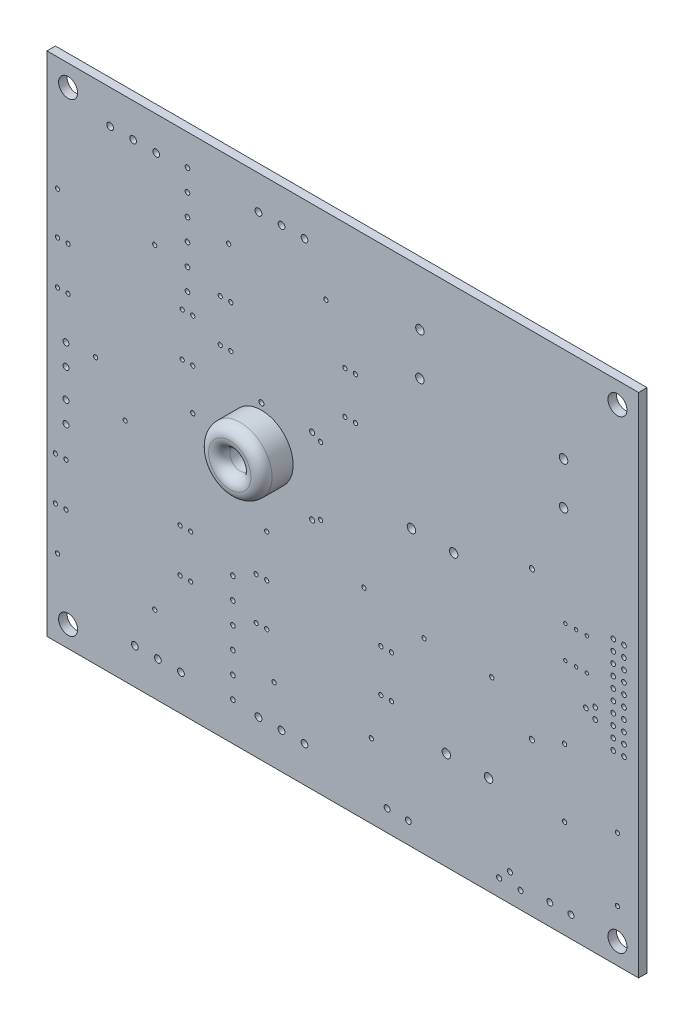
from build123d import *

# Parameters (mm, degrees)
SKETCH_1_W          = 140
SKETCH_1_H          = 120
SKETCH_1_R          = 2.25
EXTRUDE_1_DEPTH     = 2
SKETCH_2_R          = 0.55
SKETCH_2_R_2        = 0.5
SKETCH_2_R_3        = 0.8
CUT_EXTRUDE_1_DEPTH = 2
SKETCH_3_R          = 0.4
SKETCH_3_R_2        = 0.55
SKETCH_3_R_3        = 0.7
SKETCH_3_R_4        = 0.6
SKETCH_3_R_5        = 0.5
SKETCH_3_R_6        = 1
CUT_EXTRUDE_2_DEPTH = 10
SKETCH_4_R          = 0.6
SKETCH_4_R_2        = 0.5
CUT_EXTRUDE_3_DEPTH = 10
SKETCH_5_R          = 7.5
SKETCH_5_R_2        = 2.5
EXTRUDE_2_DEPTH     = 7.5
FILLET_1_R          = 2.5


with BuildPart() as part:
    # Эскиз1 → Вытянуть1 (new body)
    with BuildSketch(Plane.XY):
        Rectangle(SKETCH_1_W, SKETCH_1_H)
        with Locations((-65, -55)):
            Circle(SKETCH_1_R, mode=Mode.SUBTRACT)
        with Locations(Location((65, -55, 0), (0, 0, 180))):
            Circle(SKETCH_1_R, mode=Mode.SUBTRACT)
        with Locations((65, 55)):
            Circle(SKETCH_1_R, mode=Mode.SUBTRACT)
        with Locations(Location((-65, 55, 0), (0, 0, 180))):
            Circle(SKETCH_1_R, mode=Mode.SUBTRACT)
    extrude(amount=EXTRUDE_1_DEPTH)

    # Эскиз2 → Вырез-Вытянуть1 (cut)
    with BuildSketch(Plane.XY.offset(2)):
        with Locations((64, 6.5)):
            Circle(SKETCH_2_R)
        with Locations((66.54, 6.5)):
            Circle(SKETCH_2_R)
        with Locations((64, 3.96)):
            Circle(SKETCH_2_R)
        with Locations((66.54, 3.96)):
            Circle(SKETCH_2_R)
        with Locations((64, 1.42)):
            Circle(SKETCH_2_R)
        with Locations((66.54, 1.42)):
            Circle(SKETCH_2_R)
        with Locations((64, -1.12)):
            Circle(SKETCH_2_R)
        with Locations((66.54, -1.12)):
            Circle(SKETCH_2_R)
        with Locations((64, -3.66)):
            Circle(SKETCH_2_R)
        with Locations((66.54, -3.66)):
            Circle(SKETCH_2_R)
        with Locations((64, -6.2)):
            Circle(SKETCH_2_R)
        with Locations((66.54, -6.2)):
            Circle(SKETCH_2_R)
        with Locations((64, -8.74)):
            Circle(SKETCH_2_R)
        with Locations((66.54, -8.74)):
            Circle(SKETCH_2_R)
        with Locations((64, -11.28)):
            Circle(SKETCH_2_R)
        with Locations((66.54, -11.28)):
            Circle(SKETCH_2_R)
        with Locations((64, -13.82)):
            Circle(SKETCH_2_R)
        with Locations((66.54, -13.82)):
            Circle(SKETCH_2_R)
        with Locations((64, -16.36)):
            Circle(SKETCH_2_R)
        with Locations((66.54, -16.36)):
            Circle(SKETCH_2_R)
        with Locations((65, -47.75)):
            Circle(SKETCH_2_R_2)
        with Locations((65, -32.75)):
            Circle(SKETCH_2_R_2)
        with Locations((-55.05, 52)):
            Circle(SKETCH_2_R_3)
        with Locations((-49.6, 52)):
            Circle(SKETCH_2_R_3)
        with Locations((-44.15, 52)):
            Circle(SKETCH_2_R_3)
        with Locations((-19.95, 52)):
            Circle(SKETCH_2_R_3)
        with Locations((-14.5, 52)):
            Circle(SKETCH_2_R_3)
        with Locations((-9.05, 52)):
            Circle(SKETCH_2_R_3)
        with Locations((-49.2, -51.5)):
            Circle(SKETCH_2_R_3)
        with Locations((-43.75, -51.5)):
            Circle(SKETCH_2_R_3)
        with Locations((-38.3, -51.5)):
            Circle(SKETCH_2_R_3)
        with Locations((-19.95, -51.5)):
            Circle(SKETCH_2_R_3)
        with Locations((-14.5, -51.5)):
            Circle(SKETCH_2_R_3)
        with Locations((-9.05, -51.5)):
            Circle(SKETCH_2_R_3)
        with Locations((-26, -50.95)):
            Circle(SKETCH_2_R)
        with Locations((-26, -45.87)):
            Circle(SKETCH_2_R)
        with Locations((-26, -40.79)):
            Circle(SKETCH_2_R)
        with Locations((-26, -35.71)):
            Circle(SKETCH_2_R)
        with Locations((-26, -30.63)):
            Circle(SKETCH_2_R)
        with Locations((-26, -25.55)):
            Circle(SKETCH_2_R)
        with Locations((-36.75, 27.3)):
            Circle(SKETCH_2_R)
        with Locations((-36.75, 32.38)):
            Circle(SKETCH_2_R)
        with Locations((-36.75, 37.46)):
            Circle(SKETCH_2_R)
        with Locations((-36.75, 42.54)):
            Circle(SKETCH_2_R)
        with Locations((-36.75, 47.62)):
            Circle(SKETCH_2_R)
        with Locations((-36.75, 52.7)):
            Circle(SKETCH_2_R)
        with Locations((19.25, -15.75)):
            Circle(SKETCH_2_R_2)
        with Locations((35.25, -15.75)):
            Circle(SKETCH_2_R_2)
        with Locations((-5.25, -3.75)):
            Circle(SKETCH_2_R_2)
        with Locations((-5.25, 12.25)):
            Circle(SKETCH_2_R_2)
    extrude(amount=-CUT_EXTRUDE_1_DEPTH, mode=Mode.SUBTRACT)

    # Эскиз3 → Вырез-Вытянуть2 (cut)
    with BuildSketch(Plane.XY.offset(2)):
        with Locations((57.75, 4)):
            Circle(SKETCH_3_R)
        with Locations((57.75, -3.62)):
            Circle(SKETCH_3_R)
        with Locations((55.21, -3.62)):
            Circle(SKETCH_3_R)
        with Locations((55.21, 4)):
            Circle(SKETCH_3_R)
        with Locations((52.67, -3.62)):
            Circle(SKETCH_3_R)
        with Locations((52.67, 4)):
            Circle(SKETCH_3_R)
        with Locations((59.73, -9.605)):
            Circle(SKETCH_3_R_2)
        with Locations((59.73, -12.145)):
            Circle(SKETCH_3_R_2)
        with Locations((57.54, -10.875)):
            Circle(SKETCH_3_R_2)
        with Locations((49, -55)):
            Circle(SKETCH_3_R_3)
        with Locations((10.5, -55)):
            Circle(SKETCH_3_R_3)
        with Locations((54, -55)):
            Circle(SKETCH_3_R_3)
        with Locations((15.5, -55)):
            Circle(SKETCH_3_R_3)
        with Locations((-65.5, -2.5)):
            Circle(SKETCH_3_R_3)
        with Locations((-65.5, 2.5)):
            Circle(SKETCH_3_R_3)
        with Locations((-65.5, -14.25)):
            Circle(SKETCH_3_R_3)
        with Locations((-65.5, -9.25)):
            Circle(SKETCH_3_R_3)
        with Locations((37, -56)):
            Circle(SKETCH_3_R_4)
        with Locations((42.08, -56)):
            Circle(SKETCH_3_R_4)
        with Locations((39.54, -53.46)):
            Circle(SKETCH_3_R_4)
        with Locations((52.5, -36.75)):
            Circle(SKETCH_3_R_5)
        with Locations((52.5, -20.75)):
            Circle(SKETCH_3_R_5)
        with Locations((44.75, -23.75)):
            Circle(SKETCH_3_R_4)
        with Locations((44.75, 11.25)):
            Circle(SKETCH_3_R_4)
        with Locations((52.25, 27.5)):
            Circle(SKETCH_3_R_6)
        with Locations((52.25, 37.5)):
            Circle(SKETCH_3_R_6)
        with Locations((18.25, 37)):
            Circle(SKETCH_3_R_6)
        with Locations((18.25, 47)):
            Circle(SKETCH_3_R_6)
        with Locations((16.25, 5.25)):
            Circle(SKETCH_3_R_6)
        with Locations((26.25, 5.25)):
            Circle(SKETCH_3_R_6)
        with Locations((24.5, -36.75)):
            Circle(SKETCH_3_R_6)
        with Locations((34.5, -36.75)):
            Circle(SKETCH_3_R_6)
    extrude(amount=-CUT_EXTRUDE_2_DEPTH, mode=Mode.SUBTRACT)

    # Эскиз4 → Вырез-Вытянуть3 (cut)
    with BuildSketch(Plane.XY.offset(2)):
        with Locations((-19.25, -4.75)):
            Circle(SKETCH_4_R)
        with Locations((-19.25, 2.75)):
            Circle(SKETCH_4_R)
        with Locations((-19.25, 5.75)):
            Circle(SKETCH_4_R)
        with Locations((-19.25, 13.25)):
            Circle(SKETCH_4_R)
        with Locations((-7.25, 13.25)):
            Circle(SKETCH_4_R)
        with Locations((-7.25, -4.75)):
            Circle(SKETCH_4_R)
        with Locations((-67.5, -41.75)):
            Circle(SKETCH_4_R_2)
        with Locations((-44.5, -41.75)):
            Circle(SKETCH_4_R_2)
        with Locations((-67.5, 33)):
            Circle(SKETCH_4_R_2)
        with Locations((-44.5, 33)):
            Circle(SKETCH_4_R_2)
        with Locations((-68, -31.75)):
            Circle(SKETCH_4_R_2)
        with Locations((-36, -31.75)):
            Circle(SKETCH_4_R_2)
        with Locations((-65.5, -31.75)):
            Circle(SKETCH_4_R_2)
        with Locations((-38.5, -31.75)):
            Circle(SKETCH_4_R_2)
        with Locations((-68, -21.5)):
            Circle(SKETCH_4_R_2)
        with Locations((-36, -21.5)):
            Circle(SKETCH_4_R_2)
        with Locations((-65.5, -21.5)):
            Circle(SKETCH_4_R_2)
        with Locations((-38.5, -21.5)):
            Circle(SKETCH_4_R_2)
        with Locations((-51.5, -6.5)):
            Circle(SKETCH_4_R_2)
        with Locations((-28.5, -6.5)):
            Circle(SKETCH_4_R_2)
        with Locations((-58.5, 3)):
            Circle(SKETCH_4_R_2)
        with Locations((-35.5, 3)):
            Circle(SKETCH_4_R_2)
        with Locations((-67.5, 12.75)):
            Circle(SKETCH_4_R_2)
        with Locations((-35.5, 12.75)):
            Circle(SKETCH_4_R_2)
        with Locations((-65, 12.75)):
            Circle(SKETCH_4_R_2)
        with Locations((-38, 12.75)):
            Circle(SKETCH_4_R_2)
        with Locations((-67.5, 23)):
            Circle(SKETCH_4_R_2)
        with Locations((-35.5, 23)):
            Circle(SKETCH_4_R_2)
        with Locations((-65, 23)):
            Circle(SKETCH_4_R_2)
        with Locations((-38, 23)):
            Circle(SKETCH_4_R_2)
        with Locations((-29, 20.25)):
            Circle(SKETCH_4_R_2)
        with Locations((3, 20.25)):
            Circle(SKETCH_4_R_2)
        with Locations((-26.5, 20.25)):
            Circle(SKETCH_4_R_2)
        with Locations((0.5, 20.25)):
            Circle(SKETCH_4_R_2)
        with Locations((-29, 30.25)):
            Circle(SKETCH_4_R_2)
        with Locations((3, 30.25)):
            Circle(SKETCH_4_R_2)
        with Locations((-26.5, 30.25)):
            Circle(SKETCH_4_R_2)
        with Locations((0.5, 30.25)):
            Circle(SKETCH_4_R_2)
        with Locations((-27, 42)):
            Circle(SKETCH_4_R_2)
        with Locations((-4, 42)):
            Circle(SKETCH_4_R_2)
        with Locations((-16.25, -42.5)):
            Circle(SKETCH_4_R_2)
        with Locations((6.75, -42.5)):
            Circle(SKETCH_4_R_2)
        with Locations((-20.5, -32.5)):
            Circle(SKETCH_4_R_2)
        with Locations((11.5, -32.5)):
            Circle(SKETCH_4_R_2)
        with Locations((-18, -32.5)):
            Circle(SKETCH_4_R_2)
        with Locations((9, -32.5)):
            Circle(SKETCH_4_R_2)
        with Locations((-20.5, -22.5)):
            Circle(SKETCH_4_R_2)
        with Locations((11.5, -22.5)):
            Circle(SKETCH_4_R_2)
        with Locations((-18, -22.5)):
            Circle(SKETCH_4_R_2)
        with Locations((9, -22.5)):
            Circle(SKETCH_4_R_2)
        with Locations((-18, -12.5)):
            Circle(SKETCH_4_R_2)
        with Locations((5, -12.5)):
            Circle(SKETCH_4_R_2)
    extrude(amount=-CUT_EXTRUDE_3_DEPTH, mode=Mode.SUBTRACT)

    # Эскиз5 → Вытянуть2 (add)
    with BuildSketch(Plane.XY.offset(2)):
        with Locations(Location((-19.25, 4.25, 0), (0, 0, 180))):
            Circle(SKETCH_5_R)
        with Locations((-19.25, 4.25)):
            Circle(SKETCH_5_R_2, mode=Mode.SUBTRACT)
    extrude(amount=EXTRUDE_2_DEPTH)

    # Скругление1
    fillet_1_edges = [part.edges().sort_by_distance(p)[0] for p in [
        (-11.75, 4.25, 9.5),
        (-21.75, 4.25, 9.5),
    ]]
    fillet(fillet_1_edges, radius=FILLET_1_R - 0.0001)  # a hair under: the kernel refuses the full size


solid = part.part
